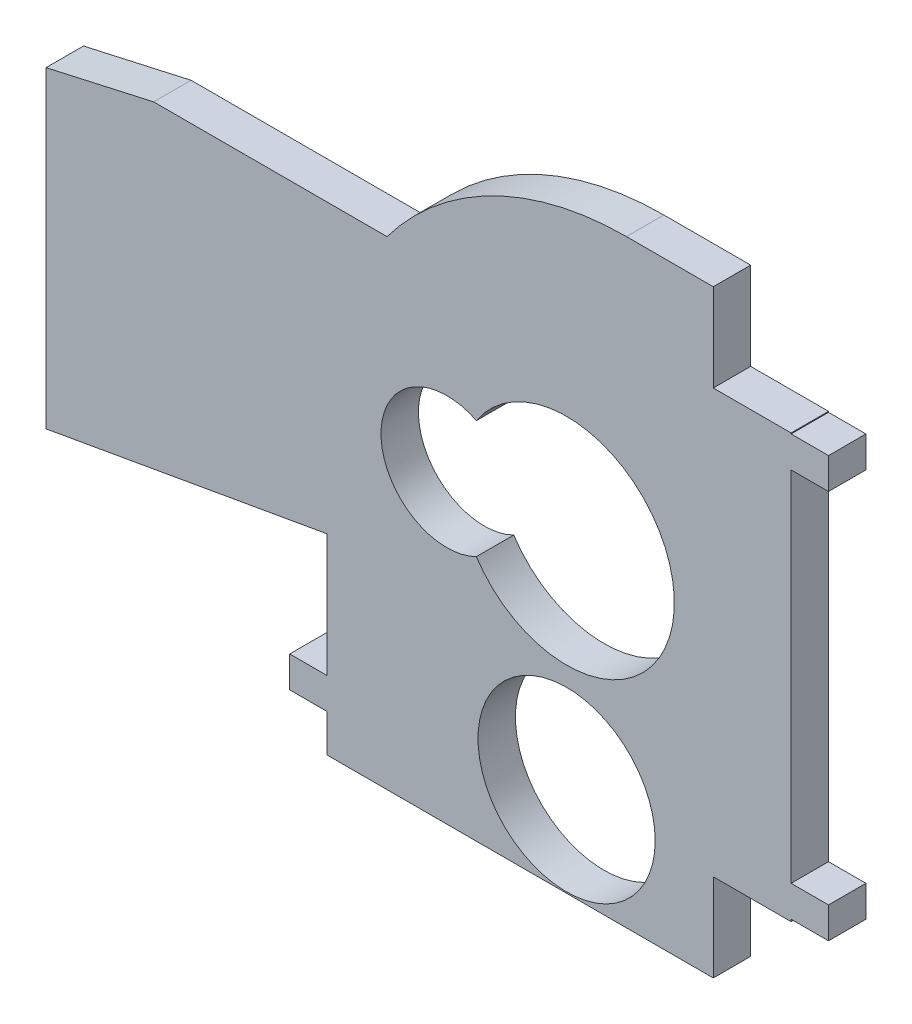
from build123d import *

# Parameters (mm, degrees)
SKETCH1_R           = 3.7592
BOSS_EXTRUDE1_DEPTH = 1.5875
CUT_EXTRUDE1_REACH  = 32.926
SKETCH2_W           = 3.302
SKETCH2_H           = 3.7211


with BuildPart() as part:
    # Sketch1 → Boss-Extrude1 (new body)
    with BuildSketch(Plane.XY):
        with BuildLine():
            Line((11.1125, 17.8308), (9.525, 17.8308))
            Line((9.525, 17.8308), (9.525, 21.59))
            Line((9.525, 21.59), (2.54, 21.59))
            ThreePointArc((2.54, 21.59), (-3.139612663, 20.249225326), (-7.62, 16.51))
            Line((-7.62, 16.51), (-17.51946076, 16.51))
            Line((-17.51946076, 16.51), (-22.084921519, 15.486982224))
            Line((-22.084921519, 15.486982224), (-22.084921519, 2.212007412))
            Line((-22.084921519, 2.212007412), (-10.16, 4.318))
            Line((-10.16, 4.318), (-10.16, -0.889))
            Line((-10.16, -0.889), (-11.7475, -0.889))
            Line((-11.7475, -0.889), (-11.7475, -2.2098))
            Line((-11.7475, -2.2098), (-10.16, -2.2098))
            Line((-10.16, -2.2098), (-10.16, -3.81))
            Line((-10.16, -3.81), (9.525, -3.81))
            Line((9.525, -3.81), (9.525, 0))
            Line((9.525, 0), (11.1125, 0))
            Line((11.1125, 0), (11.1125, 1.3208))
            Line((11.1125, 1.3208), (9.525, 1.3208))
            Line((9.525, 1.3208), (9.525, 16.51))
            Line((9.525, 16.51), (11.1125, 16.51))
            Line((11.1125, 16.51), (11.1125, 17.8308))
        make_face()
        with BuildLine():
            ThreePointArc((-3.82905, 6.645688551), (-7.874, 9.144), (-3.82905, 11.642311449))
            ThreePointArc((-3.82905, 11.642311449), (4.572, 9.144), (-3.82905, 6.645688551))
        make_face(mode=Mode.SUBTRACT)
        Circle(SKETCH1_R, mode=Mode.SUBTRACT)
    extrude(amount=BOSS_EXTRUDE1_DEPTH)

    # Sketch2 → Cut-Extrude1 (cut, up to next)
    with BuildSketch(Plane.XY.offset(1.5875), mode=Mode.PRIVATE) as cut_extrude1_sk1:
        with Locations((7.874, -1.94945)):
            Rectangle(SKETCH2_W, SKETCH2_H)
    cut_extrude1_tool1 = extrude(cut_extrude1_sk1.sketch, amount=-CUT_EXTRUDE1_REACH, mode=Mode.PRIVATE) & part.part
    # Sketch2 → Cut-Extrude1 (cut, up to next)
    with BuildSketch(Plane.XY.offset(1.5875), mode=Mode.PRIVATE) as cut_extrude1_sk2:
        with Locations((7.874, 19.72945)):
            Rectangle(SKETCH2_W, SKETCH2_H)
    cut_extrude1_tool2 = extrude(cut_extrude1_sk2.sketch, amount=-CUT_EXTRUDE1_REACH, mode=Mode.PRIVATE) & part.part
    add(cut_extrude1_tool1.solids().sort_by_distance((7.874, -1.94945, 1.5875))[0], mode=Mode.SUBTRACT)
    add(cut_extrude1_tool2.solids().sort_by_distance((7.874, 19.72945, 1.5875))[0], mode=Mode.SUBTRACT)


solid = part.part
